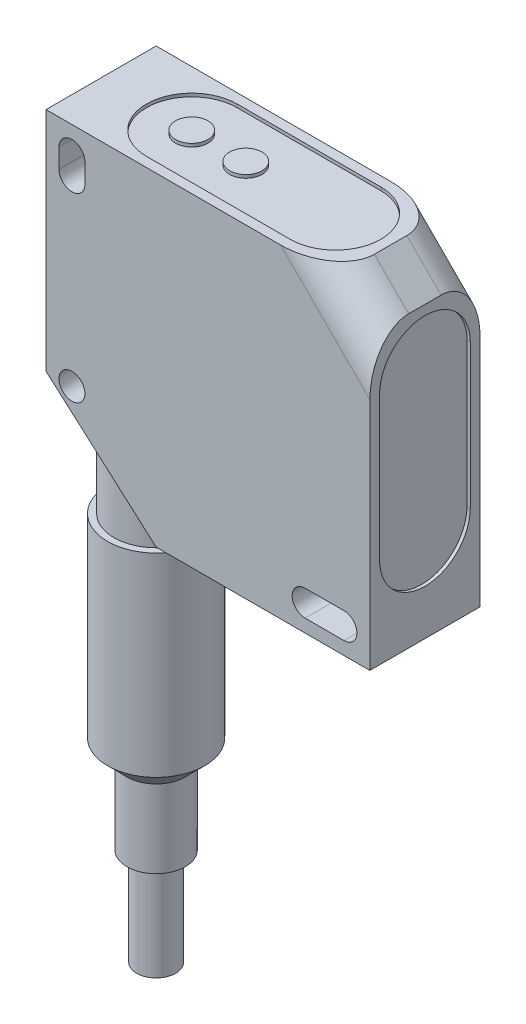
from build123d import *

# Parameters (mm, degrees)
ESQUISSE1_R                  = 2
EXTRUSION1_DEPTH             = 17
CONG_1_R                     = 6
ESQUISSE5_R                  = 6.5
EXTRUSION3_DEPTH             = 4
EXTRUSION3_DIRECTION_2_REACH = 74.726
ESQUISSE6_R                  = 7.5
EXTRUSION4_DEPTH             = 30
ESQUISSE7_R                  = 4.5
EXTRUSION5_DEPTH             = 15
CHANFREIN2_SIZE              = 3
ESQUISSE8_R                  = 3
EXTRUSION6_DEPTH             = 15
CHANFREIN3_SIZE              = 1
EXTRUSION7_DEPTH             = 0.5
ESQUISSE10_R                 = 2.5
EXTRUSION8_DEPTH             = 0.5


with BuildPart() as part:
    # Esquisse1 → Extrusion1 (new body)
    with BuildSketch(Plane.XY):
        Polygon((0, 50), (0, 15), (17, 0), (50, 0), (50, 44.696699141), (44.696699141, 50), align=None)
        with Locations((4, 15)):
            Circle(ESQUISSE1_R, mode=Mode.SUBTRACT)
        with BuildLine():
            Line((2, 43), (2, 46))
            ThreePointArc((2, 46), (4, 48), (6, 46))
            Line((6, 46), (6, 43))
            ThreePointArc((6, 43), (4, 41), (2, 43))
        make_face(mode=Mode.SUBTRACT)
        with BuildLine():
            Line((40, 6), (46, 6))
            ThreePointArc((46, 6), (48, 4), (46, 2))
            Line((46, 2), (40, 2))
            ThreePointArc((40, 2), (38, 4), (40, 6))
        make_face(mode=Mode.SUBTRACT)
    extrude(amount=EXTRUSION1_DEPTH)

    # Congé1
    cong_1_edges = [part.edges().sort_by_distance(p)[0] for p in [
        (47.348349571, 47.348349571, 17),
        (47.348349571, 47.348349571, 0),
    ]]
    fillet(cong_1_edges, radius=CONG_1_R)

    # Esquisse5 → Extrusion3 (add)
    with BuildSketch(Plane.XZ):
        with Locations(Location((8.5, 8.5, 0), (0, 0, 270))):
            Circle(ESQUISSE5_R)
    extrude(amount=EXTRUSION3_DEPTH)

    # Esquisse5 → Extrusion3 direction 2 (add, up to next)
    with BuildSketch(Plane.XZ, mode=Mode.PRIVATE) as extrusion3_direction_2_sk1:
        with Locations(Location((8.5, 8.5, 0), (0, 0, 270))):
            Circle(ESQUISSE5_R)
    extrusion3_direction_2_tool1 = extrude(extrusion3_direction_2_sk1.sketch, amount=-EXTRUSION3_DIRECTION_2_REACH, mode=Mode.PRIVATE) - part.part
    add(extrusion3_direction_2_tool1.solids().sort_by_distance((8.5, 0, 8.5))[0])

    # Esquisse6 → Extrusion4 (add)
    with BuildSketch(Plane.XZ.offset(4)):
        with Locations(Location((8.5, 8.5, 0), (0, 0, 270))):
            Circle(ESQUISSE6_R)
    extrude(amount=EXTRUSION4_DEPTH)

    # Esquisse7 → Extrusion5 (add)
    with BuildSketch(Plane.XZ.offset(34)):
        with Locations(Location((8.5, 8.5, 0), (0, 0, 270))):
            Circle(ESQUISSE7_R)
    extrude(amount=EXTRUSION5_DEPTH)

    # Chanfrein2
    chanfrein2_edges = [part.edges().sort_by_distance(p)[0] for p in [
        (8.5, -34, 13),
    ]]
    chamfer(chanfrein2_edges, length=CHANFREIN2_SIZE - 0.0001)  # a hair under: the kernel refuses the full size

    # Esquisse8 → Extrusion6 (add)
    with BuildSketch(Plane.XZ.offset(49)):
        with Locations(Location((8.5, 8.5, 0), (0, 0, 270))):
            Circle(ESQUISSE8_R)
    extrude(amount=EXTRUSION6_DEPTH)

    # Chanfrein3
    chanfrein3_edges = [part.edges().sort_by_distance(p)[0] for p in [
        (8.5, -49, 11.5),
    ]]
    chamfer(chanfrein3_edges, length=CHANFREIN3_SIZE)

    # Esquisse9 → Extrusion7 (cut)
    with BuildSketch(Plane(origin=(50, 0, 0), x_dir=(0, 0, -1), z_dir=(1, 0, 0))):
        with BuildLine():
            Line((-15.5, 14), (-15.5, 36.196699141))
            ThreePointArc((-15.5, 36.196699141), (-8.5, 43.196699141), (-1.5, 36.196699141))
            Line((-1.5, 36.196699141), (-1.5, 14))
            ThreePointArc((-1.5, 14), (-8.5, 7), (-15.5, 14))
        make_face()
    extrude(amount=-EXTRUSION7_DEPTH, mode=Mode.SUBTRACT)

    # Esquisse10 → Extrusion8 (cut)
    with BuildSketch(Plane(origin=(0, 50, 0), x_dir=(1, 0, 0), z_dir=(0, 1, 0))):
        with BuildLine():
            Line((14, -1.5), (36.196699141, -1.5))
            ThreePointArc((36.196699141, -1.5), (43.196699141, -8.5), (36.196699141, -15.5))
            Line((36.196699141, -15.5), (14, -15.5))
            ThreePointArc((14, -15.5), (7, -8.5), (14, -1.5))
        make_face()
        with Locations(Location((14, -8.5, 0), (0, 0, 180))):
            Circle(ESQUISSE10_R, mode=Mode.SUBTRACT)
        with Locations(Location((22.348349571, -8.5, 0), (0, 0, 180))):
            Circle(ESQUISSE10_R, mode=Mode.SUBTRACT)
    extrude(amount=-EXTRUSION8_DEPTH, mode=Mode.SUBTRACT)


solid = part.part
